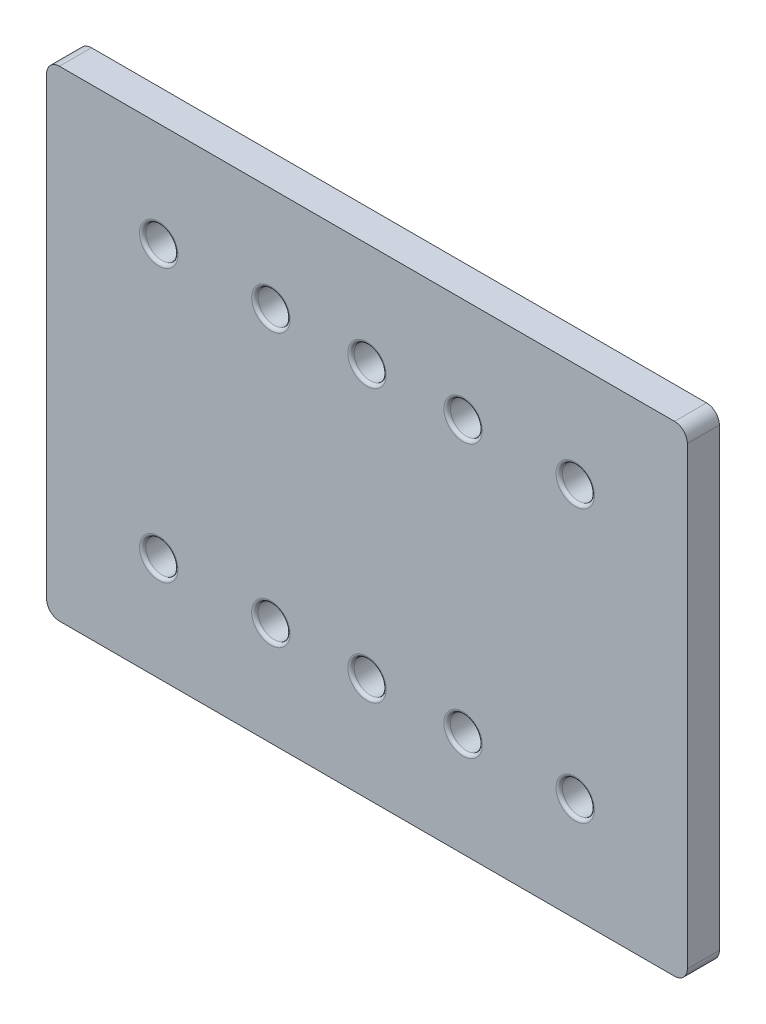
from build123d import *

# Parameters (mm, degrees)
STOCK_MASTER_BODY_001_1_START     = 1893
STOCK_MASTER_BODY_001_1_OUTLINE_W = 100
STOCK_MASTER_BODY_001_1_OUTLINE_H = 75
STOCK_MASTER_BODY_001_1_OUTLINE_R = 2.5
STOCK_MASTER_BODY_001_1_DEPTH     = 5
FILLET1_R                         = 2
FILLET2_R                         = 0.5


# Read off the part's stored shape, not the designer's step: Stock-master_body_001-1
with BuildPart() as part:
    # Stock-master_body_001-1 outline → Stock-master_body_001-1 (new body)
    with BuildSketch(Plane.XY.offset(STOCK_MASTER_BODY_001_1_START)):
        with Locations((200, 122.5)):
            Rectangle(STOCK_MASTER_BODY_001_1_OUTLINE_W, STOCK_MASTER_BODY_001_1_OUTLINE_H)
        with Locations((167.5, 101.25)):
            Circle(STOCK_MASTER_BODY_001_1_OUTLINE_R, mode=Mode.SUBTRACT)
        with Locations((185, 101.25)):
            Circle(STOCK_MASTER_BODY_001_1_OUTLINE_R, mode=Mode.SUBTRACT)
        with Locations((200, 101.25)):
            Circle(STOCK_MASTER_BODY_001_1_OUTLINE_R, mode=Mode.SUBTRACT)
        with Locations((215, 101.25)):
            Circle(STOCK_MASTER_BODY_001_1_OUTLINE_R, mode=Mode.SUBTRACT)
        with Locations((232.5, 101.25)):
            Circle(STOCK_MASTER_BODY_001_1_OUTLINE_R, mode=Mode.SUBTRACT)
        with Locations((167.5, 143.75)):
            Circle(STOCK_MASTER_BODY_001_1_OUTLINE_R, mode=Mode.SUBTRACT)
        with Locations((185, 143.75)):
            Circle(STOCK_MASTER_BODY_001_1_OUTLINE_R, mode=Mode.SUBTRACT)
        with Locations((200, 143.75)):
            Circle(STOCK_MASTER_BODY_001_1_OUTLINE_R, mode=Mode.SUBTRACT)
        with Locations((215, 143.75)):
            Circle(STOCK_MASTER_BODY_001_1_OUTLINE_R, mode=Mode.SUBTRACT)
        with Locations((232.5, 143.75)):
            Circle(STOCK_MASTER_BODY_001_1_OUTLINE_R, mode=Mode.SUBTRACT)
    extrude(amount=STOCK_MASTER_BODY_001_1_DEPTH)

    # Fillet1
    fillet1_edges = [part.edges().sort_by_distance(p)[0] for p in [
        (250, 85, 1895.5),
        (150, 85, 1895.5),
        (150, 160, 1895.5),
        (250, 160, 1895.5),
    ]]
    fillet(fillet1_edges, radius=FILLET1_R)

    # Fillet2
    fillet2_edges = [part.edges().sort_by_distance(p)[0] for p in [
        (212.5, 143.75, 1898),
        (212.5, 143.75, 1893),
        (182.5, 143.75, 1898),
        (182.5, 143.75, 1893),
        (182.5, 101.25, 1898),
        (182.5, 101.25, 1893),
        (212.5, 101.25, 1898),
        (212.5, 101.25, 1893),
        (230, 143.75, 1898),
        (230, 143.75, 1893),
        (165, 143.75, 1898),
        (165, 143.75, 1893),
        (165, 101.25, 1898),
        (165, 101.25, 1893),
        (197.5, 143.75, 1898),
        (197.5, 143.75, 1893),
        (230, 101.25, 1898),
        (230, 101.25, 1893),
        (197.5, 101.25, 1898),
        (197.5, 101.25, 1893),
    ]]
    fillet(fillet2_edges, radius=FILLET2_R)


solid = part.part
